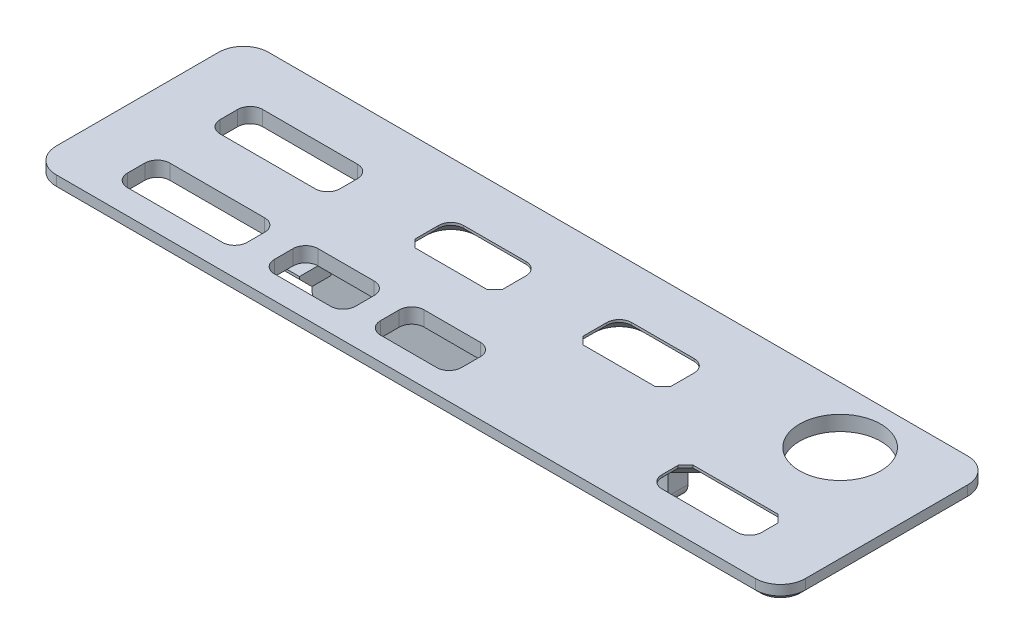
from build123d import *

# Parameters (mm, degrees)
SKETCH_1_W          = 60
SKETCH_1_H          = 17
EXTRUDE_1_DEPTH     = 1.2
CUT_EXTRUDE_1_REACH = 33.204
SKETCH_4_R          = 3.25
SKETCH_4_W          = 9.6
SKETCH_4_H          = 3.4
SKETCH_4_W_2        = 7
SKETCH_4_H_2        = 3.5
SKETCH_4_W_3        = 8
SKETCH_4_H_3        = 2.9
SKETCH_4_W_4        = 6.5
FILLET_2_R          = 1
CHAMFER_1_SIZE      = 0.6
SKETCH_5_W          = 1.5
SKETCH_5_H          = 8
EXTRUDE_2_DEPTH     = 1.2
SKETCH_6_W          = 28.5
SKETCH_6_H          = 1.6
EXTRUDE_3_DEPTH     = 4
FILLET_3_R          = 1
CHAMFER_2_SIZE      = 1
CHAMFER_4_SIZE      = 1
FILLET_4_R          = 2
CHAMFER_5_SIZE      = 0.4


with BuildPart() as part:
    # 草图1 → 凸台-拉伸1 (new body)
    with BuildSketch(Plane(origin=(0, 0, 0), x_dir=(1, 0, 0), z_dir=(0, 1, 0))):
        Rectangle(SKETCH_1_W, SKETCH_1_H)
    extrude(amount=EXTRUDE_1_DEPTH)

    # 草图4 → 切除-拉伸1 (cut, up to next)
    with BuildSketch(Plane(origin=(0, 1.2, 0), x_dir=(1, 0, 0), z_dir=(0, 1, 0)), mode=Mode.PRIVATE) as cut_extrude_1_sk1:
        with Locations((22.298485985, 3.98318929)):
            Circle(SKETCH_4_R)
    cut_extrude_1_tool1 = extrude(cut_extrude_1_sk1.sketch, amount=-CUT_EXTRUDE_1_REACH, mode=Mode.PRIVATE) & part.part
    # 草图4 → 切除-拉伸1 (cut, up to next)
    with BuildSketch(Plane(origin=(0, 1.2, 0), x_dir=(1, 0, 0), z_dir=(0, 1, 0)), mode=Mode.PRIVATE) as cut_extrude_1_sk2:
        with Locations((-20.471722325, 2.6)):
            Rectangle(SKETCH_4_W, SKETCH_4_H)
    cut_extrude_1_tool2 = extrude(cut_extrude_1_sk2.sketch, amount=-CUT_EXTRUDE_1_REACH, mode=Mode.PRIVATE) & part.part
    # 草图4 → 切除-拉伸1 (cut, up to next)
    with BuildSketch(Plane(origin=(0, 1.2, 0), x_dir=(1, 0, 0), z_dir=(0, 1, 0)), mode=Mode.PRIVATE) as cut_extrude_1_sk3:
        with Locations((-5.682926277, 2.55)):
            Rectangle(SKETCH_4_W_2, SKETCH_4_H_2)
    cut_extrude_1_tool3 = extrude(cut_extrude_1_sk3.sketch, amount=-CUT_EXTRUDE_1_REACH, mode=Mode.PRIVATE) & part.part
    # 草图4 → 切除-拉伸1 (cut, up to next)
    with BuildSketch(Plane(origin=(0, 1.2, 0), x_dir=(1, 0, 0), z_dir=(0, 1, 0)), mode=Mode.PRIVATE) as cut_extrude_1_sk4:
        with Locations((7.788485985, 2.55)):
            Rectangle(SKETCH_4_W_2, SKETCH_4_H_2)
    cut_extrude_1_tool4 = extrude(cut_extrude_1_sk4.sketch, amount=-CUT_EXTRUDE_1_REACH, mode=Mode.PRIVATE) & part.part
    # 草图4 → 切除-拉伸1 (cut, up to next)
    with BuildSketch(Plane(origin=(0, 1.2, 0), x_dir=(1, 0, 0), z_dir=(0, 1, 0)), mode=Mode.PRIVATE) as cut_extrude_1_sk5:
        with Locations((21.05, -4.584803861)):
            Rectangle(SKETCH_4_W_3, SKETCH_4_H_3)
    cut_extrude_1_tool5 = extrude(cut_extrude_1_sk5.sketch, amount=-CUT_EXTRUDE_1_REACH, mode=Mode.PRIVATE) & part.part
    # 草图4 → 切除-拉伸1 (cut, up to next)
    with BuildSketch(Plane(origin=(0, 1.2, 0), x_dir=(1, 0, 0), z_dir=(0, 1, 0)), mode=Mode.PRIVATE) as cut_extrude_1_sk6:
        with Locations((-1.65, -4.884803861)):
            Rectangle(SKETCH_4_W_4, SKETCH_4_H_2)
    cut_extrude_1_tool6 = extrude(cut_extrude_1_sk6.sketch, amount=-CUT_EXTRUDE_1_REACH, mode=Mode.PRIVATE) & part.part
    # 草图4 → 切除-拉伸1 (cut, up to next)
    with BuildSketch(Plane(origin=(0, 1.2, 0), x_dir=(1, 0, 0), z_dir=(0, 1, 0)), mode=Mode.PRIVATE) as cut_extrude_1_sk7:
        with Locations((-10.15, -4.884803861)):
            Rectangle(SKETCH_4_W_4, SKETCH_4_H_2)
    cut_extrude_1_tool7 = extrude(cut_extrude_1_sk7.sketch, amount=-CUT_EXTRUDE_1_REACH, mode=Mode.PRIVATE) & part.part
    # 草图4 → 切除-拉伸1 (cut, up to next)
    with BuildSketch(Plane(origin=(0, 1.2, 0), x_dir=(1, 0, 0), z_dir=(0, 1, 0)), mode=Mode.PRIVATE) as cut_extrude_1_sk8:
        with Locations((-20.471722325, -4.834803861)):
            Rectangle(SKETCH_4_W, SKETCH_4_H)
    cut_extrude_1_tool8 = extrude(cut_extrude_1_sk8.sketch, amount=-CUT_EXTRUDE_1_REACH, mode=Mode.PRIVATE) & part.part
    add(cut_extrude_1_tool1.solids().sort_by_distance((22.298486, 1.2, -3.983189))[0], mode=Mode.SUBTRACT)
    add(cut_extrude_1_tool2.solids().sort_by_distance((-20.471722, 1.2, -2.6))[0], mode=Mode.SUBTRACT)
    add(cut_extrude_1_tool3.solids().sort_by_distance((-5.682926, 1.2, -2.55))[0], mode=Mode.SUBTRACT)
    add(cut_extrude_1_tool4.solids().sort_by_distance((7.788486, 1.2, -2.55))[0], mode=Mode.SUBTRACT)
    add(cut_extrude_1_tool5.solids().sort_by_distance((21.05, 1.2, 4.584804))[0], mode=Mode.SUBTRACT)
    add(cut_extrude_1_tool6.solids().sort_by_distance((-1.65, 1.2, 4.884804))[0], mode=Mode.SUBTRACT)
    add(cut_extrude_1_tool7.solids().sort_by_distance((-10.15, 1.2, 4.884804))[0], mode=Mode.SUBTRACT)
    add(cut_extrude_1_tool8.solids().sort_by_distance((-20.471722, 1.2, 4.834804))[0], mode=Mode.SUBTRACT)

    # 圆角2
    fillet_2_edges = [part.edges().sort_by_distance(p)[0] for p in [
        (-25.271722325, 0.6, -0.9),
        (-25.271722325, 0.6, -4.3),
        (-15.671722325, 0.6, -0.9),
        (-15.671722325, 0.6, -4.3),
        (-2.182926277, 0.6, -4.3),
        (-9.182926277, 0.6, -4.3),
        (4.288485985, 0.6, -4.3),
        (11.288485985, 0.6, -4.3),
        (25.05, 0.6, 6.034803861),
        (17.05, 0.6, 6.034803861),
        (1.6, 0.6, 6.634803861),
        (1.6, 0.6, 3.134803861),
        (-4.9, 0.6, 3.134803861),
        (-4.9, 0.6, 6.634803861),
        (-6.9, 0.6, 6.634803861),
        (-6.9, 0.6, 3.134803861),
        (-13.4, 0.6, 3.134803861),
        (-13.4, 0.6, 6.634803861),
        (-15.671722325, 0.6, 6.534803861),
        (-15.671722325, 0.6, 3.134803861),
        (-25.271722325, 0.6, 3.134803861),
        (-25.271722325, 0.6, 6.534803861),
    ]]
    fillet(fillet_2_edges, radius=FILLET_2_R)

    # 倒角1
    chamfer_1_edges = [part.edges().sort_by_distance(p)[0] for p in [
        (-9.182926277, 0.6, -0.8),
        (-2.182926277, 0.6, -0.8),
        (4.288485985, 0.6, -0.8),
        (11.288485985, 0.6, -0.8),
        (17.05, 0.6, 3.134803861),
        (25.05, 0.6, 3.134803861),
    ]]
    chamfer(chamfer_1_edges, length=CHAMFER_1_SIZE)

    # 草图5 → 凸台-拉伸2 (add)
    with BuildSketch(Plane.XZ):
        with Locations((-13.15891381, 0.61681071)):
            Rectangle(SKETCH_5_W, SKETCH_5_H)
        with Locations((13.84108619, 0.61681071)):
            Rectangle(SKETCH_5_W, SKETCH_5_H)
    extrude(amount=EXTRUDE_2_DEPTH)

    # 草图6 → 凸台-拉伸3 (add)
    with BuildSketch(Plane.XZ):
        with Locations((0.34108619, 1.3)):
            Rectangle(SKETCH_6_W, SKETCH_6_H)
    extrude(amount=EXTRUDE_3_DEPTH)

    # 圆角3
    fillet_3_edges = [part.edges().sort_by_distance(p)[0] for p in [
        (14.59108619, -4, 1.3),
        (-13.90891381, -4, 1.3),
    ]]
    fillet(fillet_3_edges, radius=FILLET_3_R)

    # 倒角2
    chamfer_2_edges = [part.edges().sort_by_distance(p)[0] for p in [
        (13.84108619, -1.2, -3.38318929),
        (-13.15891381, -1.2, -3.38318929),
        (13.84108619, -1.2, 4.61681071),
        (-13.15891381, -1.2, 4.61681071),
    ]]
    chamfer(chamfer_2_edges, length=CHAMFER_2_SIZE)

    # 倒角4
    chamfer_4_edges = [part.edges().sort_by_distance(p)[0] for p in [
        (11.288485985, 0, -2.35),
        (10.995592766, 0, -4.007106781),
        (7.788485985, 0, -4.3),
        (4.581379204, 0, -4.007106781),
        (10.988485985, 0, -1.1),
        (4.288485985, 0, -2.35),
        (4.588485985, 0, -1.1),
        (7.788485985, 0, -0.8),
        (-9.182926277, 0, -2.35),
        (-2.182926277, 0, -2.35),
        (-8.890033058, 0, -4.007106781),
        (-2.475819496, 0, -4.007106781),
        (-5.682926277, 0, -4.3),
        (-2.482926277, 0, -1.1),
        (-8.882926277, 0, -1.1),
        (-5.682926277, 0, -0.8),
        (17.35, 0, 3.434803861),
        (21.05, 0, 3.134803861),
        (24.75, 0, 3.434803861),
        (25.05, 0, 4.384803861),
        (17.05, 0, 4.384803861),
        (24.757106781, 0, 5.741910642),
        (17.342893219, 0, 5.741910642),
        (21.05, 0, 6.034803861),
    ]]
    chamfer(chamfer_4_edges, length=CHAMFER_4_SIZE)

    # 圆角4
    fillet_4_edges = [part.edges().sort_by_distance(p)[0] for p in [
        (30, 0.6, 8.5),
        (30, 0.6, -8.5),
        (-30, 0.6, 8.5),
        (-30, 0.6, -8.5),
    ]]
    fillet(fillet_4_edges, radius=FILLET_4_R)

    # 倒角5
    chamfer_5_edges = [part.edges().sort_by_distance(p)[0] for p in [
        (0, 0, -8.5),
        (-29.414213562, 0, -7.914213562),
        (29.414213562, 0, -7.914213562),
        (-30, 0, 0),
        (30, 0, 0),
        (-29.414213562, 0, 7.914213562),
        (29.414213562, 0, 7.914213562),
        (0, 0, 8.5),
    ]]
    chamfer(chamfer_5_edges, length=CHAMFER_5_SIZE)


solid = part.part
